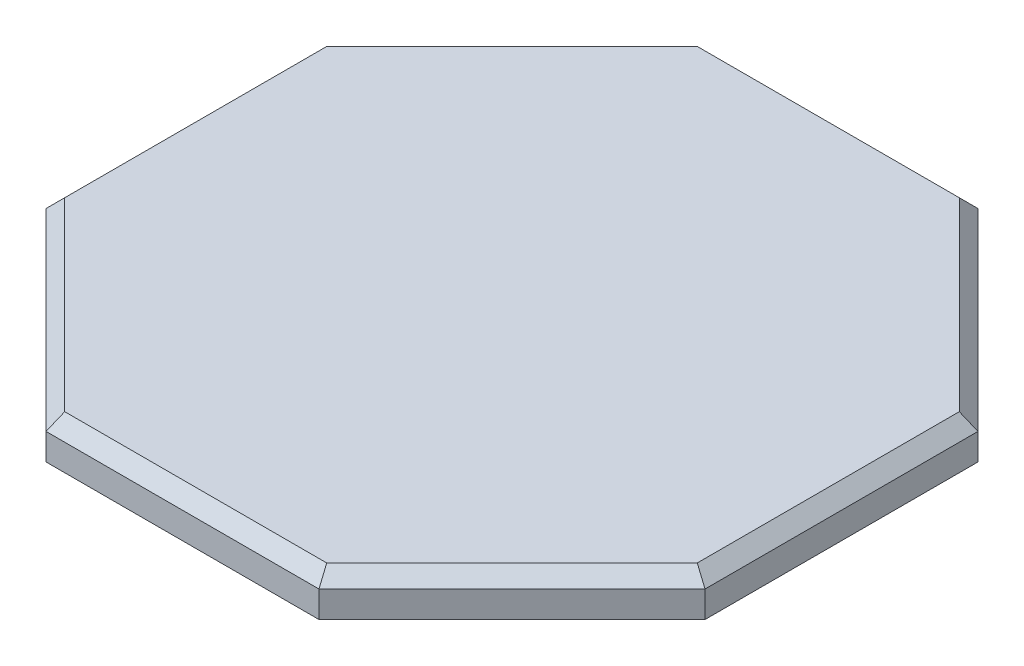
from build123d import *

# Parameters (mm, degrees)
RESSALTO_EXTRUS_O2_DEPTH = 9
CASCA1_T                 = -3
CHANFRO1_SIZE            = 3


with BuildPart() as part:
    # Esboço1 → Ressalto-extrusão2 (new body)
    with BuildSketch(Plane(origin=(0, 0, 0), x_dir=(1, 0, 0), z_dir=(0, 1, 0))):
        Polygon((30.962463787, -74.75), (74.75, -30.962463787), (74.75, 30.962463787), (30.962463787, 74.75), (-30.962463787, 74.75), (-74.75, 30.962463787), (-74.75, -30.962463787), (-30.962463787, -74.75), align=None)
    extrude(amount=RESSALTO_EXTRUS_O2_DEPTH)

    # Casca1
    casca1_openings = [part.faces().sort_by_distance(p)[0] for p in [
        (0, 0, 0),
    ]]
    offset(amount=CASCA1_T, openings=casca1_openings, kind=Kind.INTERSECTION)

    # Chanfro1
    chanfro1_edges = [part.edges().sort_by_distance(p)[0] for p in [
        (-52.856231894, 9, 52.856231894),
        (-74.75, 9, 0),
        (-52.856231894, 9, -52.856231894),
        (0, 9, -74.75),
        (52.856231894, 9, -52.856231894),
        (74.75, 9, 0),
        (52.856231894, 9, 52.856231894),
        (0, 9, 74.75),
    ]]
    chamfer(chanfro1_edges, length=CHANFRO1_SIZE)


solid = part.part
